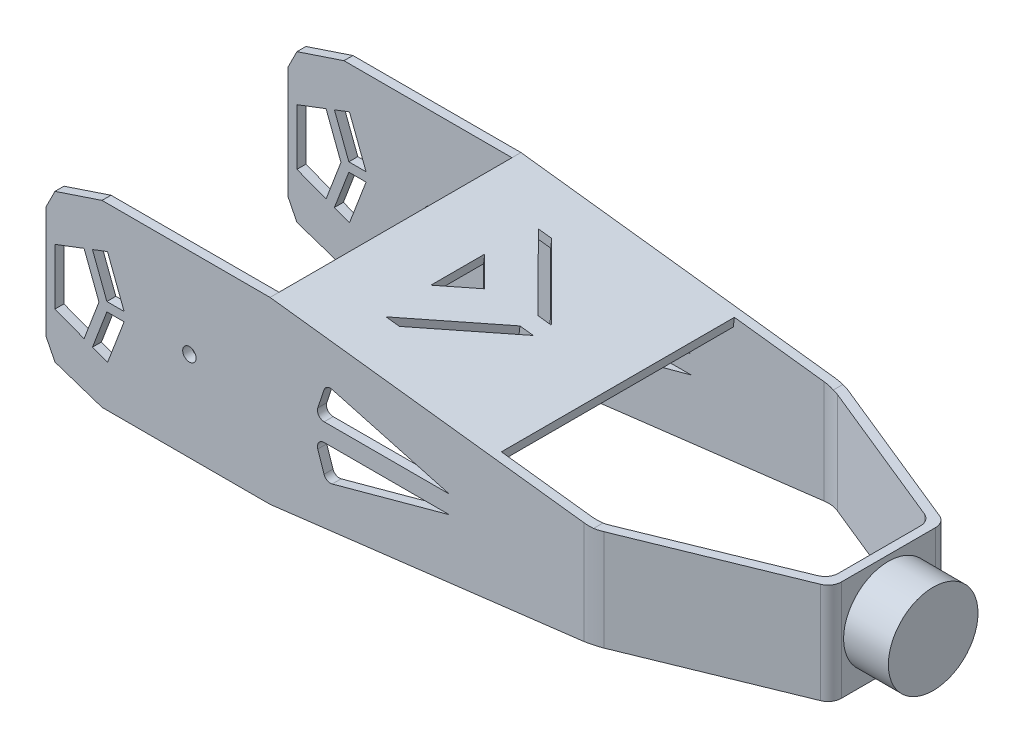
from build123d import *

# Parameters (mm, degrees)
EXTRUDE_1_DEPTH     = 20
SHELL_1_T           = -2
CUT_EXTRUDE_1_DEPTH = 100.679486355
FILLET_1_R          = 10
FILLET_2_R          = 3
SKETCH_3_W          = 50
SKETCH_3_H          = 52
EXTRUDE_2_DEPTH     = 2
SKETCH_4_R          = 10
EXTRUDE_3_DEPTH     = 10
SKETCH_5_R          = 1.5
CUT_EXTRUDE_2_DEPTH = 108.870292481
CUT_EXTRUDE_3_DEPTH = 100.19511746
CUT_EXTRUDE_4_REACH = 109.87
CUT_EXTRUDE_5_DEPTH = 108.870292481


with BuildPart() as part:
    # 草图1 → 凸台-拉伸1 (new, symmetric)
    with BuildSketch(Plane(origin=(0, 0, 0), x_dir=(1, 0, 0), z_dir=(0, 1, 0))):
        Polygon((42, -28), (-80, -28), (-80, 28), (42, 28), (80, 12.5), (80, -12.5), align=None)
    extrude(amount=EXTRUDE_1_DEPTH, both=True)

    # 抽壳1
    shell_1_openings = [part.faces().sort_by_distance(p)[0] for p in [
        (-80, 0, 0),
        (-4.737705571, -20, 0),
        (-4.737705571, 20, 0),
    ]]
    offset(amount=SHELL_1_T, openings=shell_1_openings, kind=Kind.INTERSECTION)

    # 草图2 → 切除-拉伸1 (cut, through all)
    with BuildSketch(Plane.XY.offset(28)):
        Polygon((-80, 12.5), (-78, 16.5), (-67.5, 20), (-80, 20), align=None)
        Polygon((-80, -12.5), (-78, -16.5), (-67.5, -20), (-80, -20), align=None)
        Polygon((-30, 20), (42, 11.25), (80, 11.25), (80, 20), align=None)
        Polygon((42, -11.25), (80, -11.25), (80, -20), (-30, -20), align=None)
    extrude(amount=-CUT_EXTRUDE_1_DEPTH, mode=Mode.SUBTRACT)

    # 圆角1
    fillet_1_edges = [part.edges().sort_by_distance(p)[0] for p in [
        (41.607791612, 0, 26),
        (41.607791612, 0, -26),
    ]]
    fillet(fillet_1_edges, radius=FILLET_1_R)
    fillet_1_2_edges = [part.edges().sort_by_distance(p)[0] for p in [
        (42, 0, -28),
        (42, 0, 28),
    ]]
    fillet(fillet_1_2_edges, radius=FILLET_1_R)

    # 圆角2
    fillet_2_edges = [part.edges().sort_by_distance(p)[0] for p in [
        (78, 0, 11.155809736),
        (78, 0, -11.155809736),
        (80, 0, 12.5),
        (80, 0, -12.5),
    ]]
    fillet(fillet_2_edges, radius=FILLET_2_R)

    # 草图3 → 凸台-拉伸2 (add)
    with BuildSketch(Plane(origin=(1.958559565, 16.116147275, 0), x_dir=(0.9926963020144297, -0.12064017559203144, 0), z_dir=(0.12064017559203145, 0.9926963020144298, 0))):
        with Locations((-7.193692572, 0)):
            Rectangle(SKETCH_3_W, SKETCH_3_H)
    extrude(amount=-EXTRUDE_2_DEPTH)

    # 草图4 → 凸台-拉伸3 (add)
    with BuildSketch(Plane(origin=(80, 0, 0), x_dir=(0, 0, -1), z_dir=(1, 0, 0))):
        Circle(SKETCH_4_R)
    extrude(amount=EXTRUDE_3_DEPTH)

    # 草图5 → 切除-拉伸2 (cut, through all)
    with BuildSketch(Plane.XY.offset(28)):
        with Locations((-48, 0)):
            Circle(SKETCH_5_R)
    extrude(amount=-CUT_EXTRUDE_2_DEPTH, mode=Mode.SUBTRACT)

    # 草图6 → 切除-拉伸3 (cut, through all)
    with BuildSketch(Plane(origin=(1.958559565, 16.116147275, 0), x_dir=(0.9926963020144297, -0.12064017559203144, 0), z_dir=(0.12064017559203145, 0.9926963020144298, 0))):
        Polygon((-18.193692572, -6), (-18.193692572, 6), (-12.193692572, 0), align=None)
        Polygon((-2.193692572, 2), (-17.193692572, 17), (-14.193692572, 17), (0.806307428, 2), align=None)
        Polygon((-14.193692572, -17), (0.806307428, -2), (-2.193692572, -2), (-17.193692572, -17), align=None)
    extrude(amount=-CUT_EXTRUDE_3_DEPTH, mode=Mode.SUBTRACT)

    # 草图7 → 切除-拉伸4 (cut, up to next)
    with BuildSketch(Plane.XY.offset(28), mode=Mode.PRIVATE) as cut_extrude_4_sk1:
        with BuildLine():
            Line((-17.91886117, 2), (10, 2))
            Line((10, 2), (-16.131019724, 9.126641743))
            ThreePointArc((-16.131019724, 9.126641743), (-17.233482721, 9.002007909), (-17.94872078, 8.15383766))
            Line((-17.94872078, 8.15383766), (-19.341886117, 3.974341649))
            ThreePointArc((-19.341886117, 3.974341649), (-19.135724448, 2.622934573), (-17.91886117, 2))
        make_face()
    cut_extrude_4_tool1 = extrude(cut_extrude_4_sk1.sketch, amount=-CUT_EXTRUDE_4_REACH, mode=Mode.PRIVATE) & part.part
    # 草图7 → 切除-拉伸4 (cut, up to next)
    with BuildSketch(Plane.XY.offset(28), mode=Mode.PRIVATE) as cut_extrude_4_sk2:
        with BuildLine():
            Line((-19.341886117, -3.974341649), (-17.94872078, -8.15383766))
            ThreePointArc((-17.94872078, -8.15383766), (-17.233482721, -9.002007909), (-16.131019724, -9.126641743))
            Line((-16.131019724, -9.126641743), (10, -2))
            Line((10, -2), (-17.91886117, -2))
            ThreePointArc((-17.91886117, -2), (-19.135724448, -2.622934573), (-19.341886117, -3.974341649))
        make_face()
    cut_extrude_4_tool2 = extrude(cut_extrude_4_sk2.sketch, amount=-CUT_EXTRUDE_4_REACH, mode=Mode.PRIVATE) & part.part
    cut_extrude_4_1 = cut_extrude_4_tool1.solids().sort_by_distance((-9.044619, 4.500562, 28))[0]
    add(cut_extrude_4_1, mode=Mode.SUBTRACT)
    cut_extrude_4_2 = cut_extrude_4_tool2.solids().sort_by_distance((-9.044619, -4.500562, 28))[0]
    add(cut_extrude_4_2, mode=Mode.SUBTRACT)
    cut_extrude_4 = cut_extrude_4_1 + cut_extrude_4_2  # 切除-拉伸4 as one shape, for the pattern or mirror that repeats it

    # 镜向1: 切除-拉伸4 across plane
    add(cut_extrude_4.mirror(Plane.XY), mode=Mode.SUBTRACT)

    # 草图8 → 切除-拉伸5 (cut, through all)
    with BuildSketch(Plane.XY.offset(28)):
        Polygon((-78, -6.25), (-78, 6.25), (-71.5, 8.727285854), (-68.173848955, 0), (-71.5, -8.727285854), align=None)
        Polygon((-66.414639843, 1), (-69.631129323, 9.43955153), (-66.272202597, 10.719708709), (-62.56781846, 1), align=None)
        Polygon((-66.272202597, -10.719708709), (-62.56781846, -1), (-66.414639843, -1), (-69.631129323, -9.43955153), align=None)
    extrude(amount=-CUT_EXTRUDE_5_DEPTH, mode=Mode.SUBTRACT)


solid = part.part
